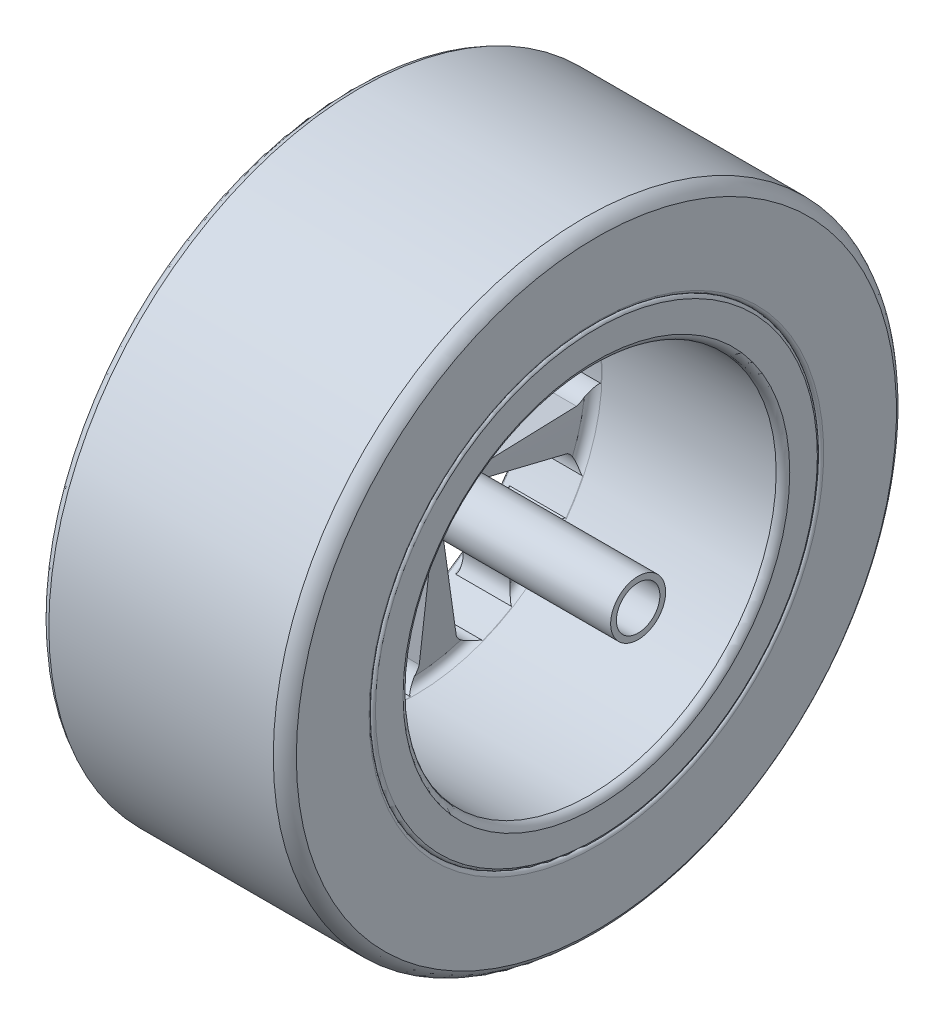
from build123d import *

# Parameters (mm, degrees)
CUT_EXTRUDE5_DEPTH = 27


# Read off the part's stored shape, not the designer's step: Revolve1
with BuildPart() as part:
    # Revolve1 outline → Revolve1 (revolve)
    with BuildSketch(Plane.YX):
        with BuildLine():
            ThreePointArc((35.11155741, 0.043758647), (35.125089748, 0.013532338), (35.155316057, 0))
            Line((35.155316057, 0), (35.531122884, 0))
            ThreePointArc((35.531122884, 0), (35.852102587, 0.147897413), (36, 0.468877116))
            Line((36, 0.468877116), (36, 0.548549103))
            ThreePointArc((36, 0.548549103), (36.178171061, 0.178171061), (36.548549103, 0))
            Line((36.548549103, 0), (48.248442912, 0))
            ThreePointArc((48.248442912, 0), (49.305645498, 0.814913131), (50, 1.954927406))
            Line((50, 1.954927406), (50, 38.045072594))
            ThreePointArc((50, 38.045072594), (49.305645498, 39.185086869), (48.248442912, 40))
            Line((48.248442912, 40), (36.548549103, 40))
            ThreePointArc((36.548549103, 40), (36.178171061, 39.821828939), (36, 39.451450897))
            ThreePointArc((36, 39.451450897), (35.879169681, 39.822833079), (35.531122884, 40))
            Line((35.531122884, 40), (31.090410536, 40))
            ThreePointArc((31.090410536, 40), (30.391018416, 39.608981584), (30, 38.909589464))
            Line((30, 38.909589464), (30, 10.913289251))
            ThreePointArc((30, 10.913289251), (29.648048361, 9.96375324), (28.727757617, 9.541197278))
            Line((28.727757617, 9.541197278), (4.422640303, 13.650257156))
            Line((4.422640303, 13.650257156), (4.422640303, 46.709711523))
            Line((4.422640303, 46.709711523), (3.5, 46.709711523))
            Line((3.5, 46.709711523), (3.5, 3.481363633))
            Line((3.5, 3.481363633), (0, 3.481363633))
            Line((0, 3.481363633), (0, 1.668295046))
            Line((0, 1.668295046), (3.661332489, 1.668295046))
            ThreePointArc((3.661332489, 1.668295046), (4.124387919, 1.96654743), (4.422640303, 2.42960286))
            Line((4.422640303, 2.42960286), (4.422640303, 3.255417462))
            ThreePointArc((4.422640303, 3.255417462), (4.588303098, 3.441897056), (4.837305369, 3.456616756))
            Line((4.837305369, 3.456616756), (29.679390914, 1.974061098))
            ThreePointArc((29.679390914, 1.974061098), (29.899947587, 1.894999905), (30, 1.68313808))
            Line((30, 1.68313808), (30, 0.833651527))
            ThreePointArc((30, 0.833651527), (30.106129424, 0.588383883), (30.331382807, 0.444576424))
            Line((30.331382807, 0.444576424), (32.628429831, 0))
            Line((32.628429831, 0), (33.031942365, 0))
            Line((33.031942365, 0), (33.031942365, 0.137488875))
            ThreePointArc((33.031942365, 0.137488875), (33.059281256, 0.229352132), (33.143569903, 0.27497775))
            Line((33.143569903, 0.27497775), (35.004753541, 0.27497775))
            ThreePointArc((35.004753541, 0.27497775), (35.086630353, 0.228353118), (35.11155741, 0.137488875))
            Line((35.11155741, 0.137488875), (35.11155741, 0.043758647))
        make_face()
    revolve(axis=Axis((0, 0, 0), (1, 0, 0)))

    # Sketch2 → Cut-Extrude5 (cut)
    with BuildSketch(Plane(origin=(0, 0, 0), x_dir=(0, 0, -1), z_dir=(1, 0, 0))):
        with BuildLine():
            ThreePointArc((-4.569584064, 1.586954542), (-4.72910861, 2.027212753), (-5.090641916, 2.324818266))
            Line((-5.090641916, 2.324818266), (-24.82918696, 11.339109746))
            ThreePointArc((-24.82918696, 11.339109746), (-26.753069708, 11.252659999), (-28.263655821, 10.05811909))
            ThreePointArc((-28.263655821, 10.05811909), (-29.038461042, 7.534439615), (-29.588402706, 4.952416109))
            ThreePointArc((-29.588402706, 4.952416109), (-28.849159863, 3.174125242), (-27.210007707, 2.163195672))
            Line((-27.210007707, 2.163195672), (-5.57877332, 0.443512491))
            Line((-5.57877332, 0.443512491), (-5.566553806, 0.44254104))
            ThreePointArc((-5.566553806, 0.44254104), (-5.112638378, 0.530473689), (-4.764700307, 0.834957619))
            ThreePointArc((-4.764700307, 0.834957619), (-4.682263451, 1.214879507), (-4.569584064, 1.586954542))
        make_face()
        with BuildLine():
            ThreePointArc((-2.986206337, 3.805534779), (-2.882385365, 4.262149035), (-3.025628849, 4.707970386))
            Line((-3.025628849, 4.707970386), (-14.757255685, 22.962738068))
            ThreePointArc((-14.757255685, 22.962738068), (-16.422467106, 23.930141454), (-18.339070583, 23.741914206))
            ThreePointArc((-18.339070583, 23.741914206), (-20.355282347, 22.03775126), (-22.213870014, 20.162935774))
            ThreePointArc((-22.213870014, 20.162935774), (-22.553395988, 18.267277445), (-21.721003236, 16.530636811))
            Line((-21.721003236, 16.530636811), (-4.453381809, 3.389219018))
            Line((-4.453381809, 3.389219018), (-4.443627305, 3.381795413))
            ThreePointArc((-4.443627305, 3.381795413), (-4.014229369, 3.210363857), (-3.556908796, 3.278402516))
            ThreePointArc((-3.556908796, 3.278402516), (-3.28215722, 3.553444417), (-2.986206337, 3.805534779))
        make_face()
        with BuildLine():
            ThreePointArc((-1.219823875, 4.680977777), (-1.030739092, 4.726214147), (-0.839989262, 4.763815832))
            Line((-0.839989262, 4.763815832), (-5.20944533, 29.54423259))
            ThreePointArc((-5.20944533, 29.54423259), (-6.50431688, 29.286410875), (-7.786590548, 28.971865795))
            ThreePointArc((-7.786590548, 28.971865795), (-9.097088242, 27.560698129), (-9.33573371, 25.649717562))
            Line((-9.33573371, 25.649717562), (-1.914073039, 5.258872454))
            Line((-1.914073039, 5.258872454), (-1.909880533, 5.247353637))
            ThreePointArc((-1.909880533, 5.247353637), (-1.641330899, 4.870986184), (-1.219823875, 4.680977777))
        make_face()
        with BuildLine():
            ThreePointArc((-0.454729197, 4.815884612), (-0.123628859, 5.138598002), (0, 5.584117105))
            Line((0, 5.584117105), (0, 5.596375174))
            Line((0, 5.596375174), (0, 27.2958593))
            ThreePointArc((0, 27.2958593), (-0.877847233, 29.00997208), (-2.591960013, 29.887819313))
            ThreePointArc((-2.591960013, 29.887819313), (-3.90448387, 29.74483158), (-5.20944533, 29.54423259))
            Line((-5.20944533, 29.54423259), (-0.839989262, 4.763815832))
            ThreePointArc((-0.839989262, 4.763815832), (-0.647882521, 4.79372209), (-0.454729197, 4.815884612))
        make_face()
        with BuildLine():
            ThreePointArc((2.22112125, 4.297225108), (2.679600977, 4.392470648), (3.025628849, 4.707970386))
            Line((3.025628849, 4.707970386), (14.757255685, 22.962738068))
            ThreePointArc((14.757255685, 22.962738068), (14.945482934, 24.879341545), (13.978079548, 26.544552966))
            ThreePointArc((13.978079548, 26.544552966), (11.590353771, 27.670628823), (9.1128764, 28.582433132))
            ThreePointArc((9.1128764, 28.582433132), (7.247480744, 28.103791892), (6.013565305, 26.62519422))
            Line((6.013565305, 26.62519422), (1.232940396, 5.458871043))
            Line((1.232940396, 5.458871043), (1.230239815, 5.446914158))
            ThreePointArc((1.230239815, 5.446914158), (1.252678535, 4.985104814), (1.504546508, 4.597375669))
            ThreePointArc((1.504546508, 4.597375669), (1.868869351, 4.461709379), (2.22112125, 4.297225108))
        make_face()
        with BuildLine():
            ThreePointArc((4.191781394, 2.414226995), (4.62897271, 2.246479787), (5.090641916, 2.324818266))
            Line((5.090641916, 2.324818266), (24.82918696, 11.339109746))
            ThreePointArc((24.82918696, 11.339109746), (26.023727869, 12.849695859), (26.110177616, 14.773578607))
            ThreePointArc((26.110177616, 14.773578607), (24.710297443, 17.011795916), (23.119069479, 19.118279903))
            ThreePointArc((23.119069479, 19.118279903), (21.291025803, 19.724130301), (19.453599826, 19.147359837))
            Line((19.453599826, 19.147359837), (3.988503967, 3.925716647))
            Line((3.988503967, 3.925716647), (3.979767713, 3.917117919))
            ThreePointArc((3.979767713, 3.917117919), (3.748971385, 3.516487889), (3.751234005, 3.054139269))
            ThreePointArc((3.751234005, 3.054139269), (3.98437515, 2.743041724), (4.191781394, 2.414226995))
        make_face()
        with BuildLine():
            ThreePointArc((4.831580563, -0.235271131), (5.108678315, -0.612752532), (5.539412144, -0.796447228))
            Line((5.539412144, -0.796447228), (27.01802681, -3.884605802))
            ThreePointArc((27.01802681, -3.884605802), (28.83962308, -3.259637471), (29.952478777, -1.687902575))
            ThreePointArc((29.952478777, -1.687902575), (29.984896271, 0.951838005), (29.78512135, 3.584207888))
            ThreePointArc((29.78512135, 3.584207888), (28.574820604, 5.082196704), (26.717253855, 5.590373995))
            Line((26.717253855, 5.590373995), (5.47774571, 1.146174953))
            Line((5.47774571, 1.146174953), (5.465747482, 1.143664418))
            ThreePointArc((5.465747482, 1.143664418), (5.054992309, 0.931410906), (4.80693121, 0.541235231))
            ThreePointArc((4.80693121, 0.541235231), (4.834869991, 0.153477703), (4.831580563, -0.235271131))
        make_face()
        with BuildLine():
            ThreePointArc((3.937387041, -2.810072335), (3.96641465, -3.277440253), (4.229458156, -3.664846354))
            Line((4.229458156, -3.664846354), (20.628834048, -17.874986455))
            ThreePointArc((20.628834048, -17.874986455), (22.499141735, -18.334058936), (24.285079561, -17.613486615))
            ThreePointArc((24.285079561, -17.613486615), (25.739502397, -15.410321747), (26.994607644, -13.087824806))
            ThreePointArc((26.994607644, -13.087824806), (26.786311763, -11.173298438), (25.498368559, -9.741516091))
            Line((25.498368559, -9.741516091), (5.227841894, -1.99726919))
            Line((5.227841894, -1.99726919), (5.216391045, -1.992894455))
            ThreePointArc((5.216391045, -1.992894455), (4.756088892, -1.949382459), (4.336461721, -2.143507169))
            ThreePointArc((4.336461721, -2.143507169), (4.150327772, -2.484814404), (3.937387041, -2.810072335))
        make_face()
        with BuildLine():
            ThreePointArc((1.793100954, -4.492695428), (1.56484236, -4.90156385), (1.576681087, -5.369682657))
            Line((1.576681087, -5.369682657), (7.690132232, -26.190185207))
            ThreePointArc((7.690132232, -26.190185207), (9.01534186, -27.58754623), (10.907339174, -27.946913106))
            ThreePointArc((10.907339174, -27.946913106), (13.321998378, -26.879813229), (15.633496746, -25.604565599))
            ThreePointArc((15.633496746, -25.604565599), (16.493338201, -23.881350273), (16.183931409, -21.980543648))
            Line((16.183931409, -21.980543648), (3.318135215, -4.506594478))
            Line((3.318135215, -4.506594478), (3.310867308, -4.496723419))
            ThreePointArc((3.310867308, -4.496723419), (2.947160856, -4.211260667), (2.489196275, -4.147701188))
            ThreePointArc((2.489196275, -4.147701188), (2.14808581, -4.334195495), (1.793100954, -4.492695428))
        make_face()
        with BuildLine():
            ThreePointArc((-0.920482016, -4.748919466), (-1.333556323, -4.969475558), (-1.576681087, -5.369682657))
            Line((-1.576681087, -5.369682657), (-7.690132232, -26.190185207))
            ThreePointArc((-7.690132232, -26.190185207), (-7.330765356, -28.082182521), (-5.933404333, -29.407392149))
            ThreePointArc((-5.933404333, -29.407392149), (-3.325145997, -29.815153934), (-0.691138908, -29.992037727))
            ThreePointArc((-0.691138908, -29.992037727), (0.963846296, -29.007242133), (1.731210387, -27.240903904))
            Line((1.731210387, -27.240903904), (0.354944049, -5.58510786))
            Line((0.354944049, -5.58510786), (0.354166595, -5.572874471))
            ThreePointArc((0.354166595, -5.572874471), (0.202530073, -5.136093369), (-0.148371401, -4.835029386))
            ThreePointArc((-0.148371401, -4.835029386), (-0.53615822, -4.807500141), (-0.920482016, -4.748919466))
        make_face()
        with BuildLine():
            ThreePointArc((-3.34181845, -3.497395128), (-3.808560296, -3.459613889), (-4.229458156, -3.664846354))
            Line((-4.229458156, -3.664846354), (-20.628834048, -17.874986455))
            ThreePointArc((-20.628834048, -17.874986455), (-21.349406369, -19.660924281), (-20.890333888, -21.531231968))
            ThreePointArc((-20.890333888, -21.531231968), (-18.916580013, -23.284393929), (-16.796342842, -24.85724979))
            ThreePointArc((-16.796342842, -24.85724979), (-14.871659997, -24.923539572), (-13.271157701, -23.852469646))
            Line((-13.271157701, -23.852469646), (-2.720939344, -4.89038896))
            Line((-2.720939344, -4.89038896), (-2.71497951, -4.879677254))
            ThreePointArc((-2.71497951, -4.879677254), (-2.606402578, -4.430252715), (-2.738832205, -3.987269917))
            ThreePointArc((-2.738832205, -3.987269917), (-3.050175802, -3.754457459), (-3.34181845, -3.497395128))
        make_face()
        with BuildLine():
            ThreePointArc((-4.702151138, -1.135472549), (-5.074373285, -0.851349254), (-5.539412144, -0.796447228))
            Line((-5.539412144, -0.796447228), (-27.01802681, -3.884605802))
            ThreePointArc((-27.01802681, -3.884605802), (-28.589761706, -4.997461499), (-29.214730037, -6.819057769))
            ThreePointArc((-29.214730037, -6.819057769), (-28.502133532, -9.361003371), (-27.568826601, -11.830460678))
            ThreePointArc((-27.568826601, -11.830460678), (-25.98551932, -12.926789298), (-24.060026988, -12.891044809))
            Line((-24.060026988, -12.891044809), (-4.93294372, -2.643006118))
            Line((-4.93294372, -2.643006118), (-4.922138804, -2.637216987))
            ThreePointArc((-4.922138804, -2.637216987), (-4.587820827, -2.317838128), (-4.459733136, -1.873580422))
            ThreePointArc((-4.459733136, -1.873580422), (-4.595784119, -1.509401062), (-4.702151138, -1.135472549))
        make_face()
    extrude(amount=CUT_EXTRUDE5_DEPTH, mode=Mode.SUBTRACT)


solid = part.part
